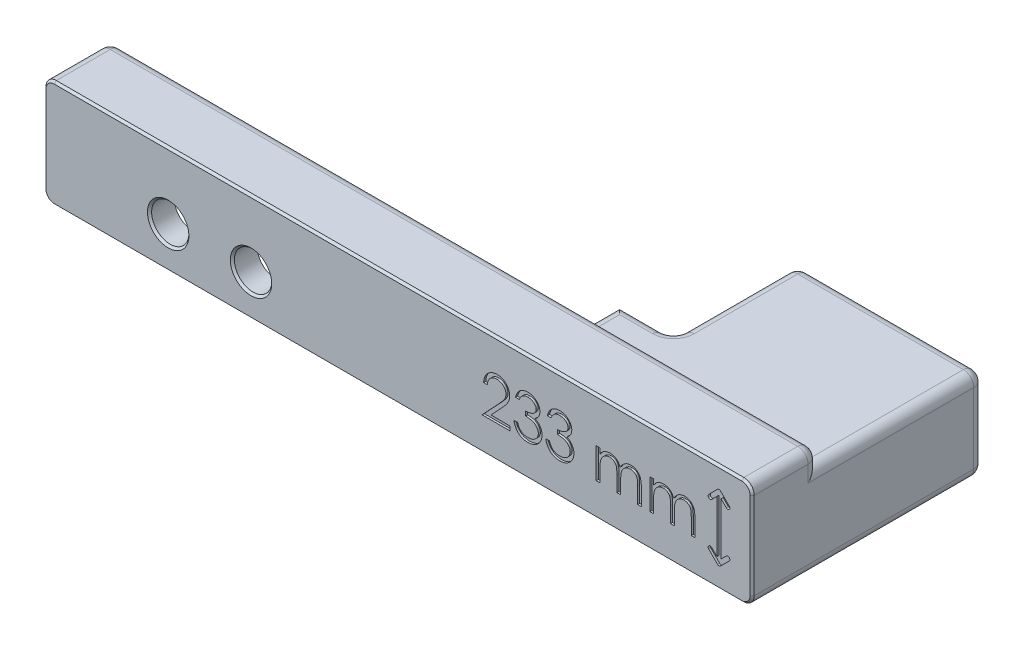
from build123d import *

# Parameters (mm, degrees)
MAIN_FEATURES_SKETCH_W   = 171
MAIN_FEATURES_SKETCH_H   = 26
MAIN_FEATURES_SKETCH_R   = 4.5
BASE_DEPTH               = 6
LEDGE_DEPTH              = 10
MAIN_FEATURES_SKETCH_4_W = 13
MAIN_FEATURES_SKETCH_4_H = 22.05
BOSS_EXTRUDE3_DEPTH      = 20
MAIN_FEATURES_SKETCH_5_W = 45
MAIN_FEATURES_SKETCH_5_H = 22.05
BOSS_EXTRUDE4_DEPTH      = 50
FILLET1_R                = 2.5
CHAMFER1_SIZE            = 0.5
CUT_EXTRUDE1_DEPTH       = 0.5
CUT_EXTRUDE2_DEPTH       = 0.5


with BuildPart() as part:
    # main_features_sketch → base (new body)
    with BuildSketch(Plane.XY):
        with Locations((79.5, 293)):
            Rectangle(MAIN_FEATURES_SKETCH_W, MAIN_FEATURES_SKETCH_H)
        with Locations((44, 290)):
            Circle(MAIN_FEATURES_SKETCH_R, mode=Mode.SUBTRACT)
        with Locations((24, 290)):
            Circle(MAIN_FEATURES_SKETCH_R, mode=Mode.SUBTRACT)
    extrude(amount=BASE_DEPTH)

    # main_features_sketch<3> → ledge (add)
    with BuildSketch(Plane.XY):
        Polygon((0, 280), (0, 300), (107, 300), (107, 302.05), (165, 302.05), (165, 306), (-6, 306), (-6, 280), align=None)
    extrude(amount=-LEDGE_DEPTH)

    # main_features_sketch<4> → Boss-Extrude3 (add)
    with BuildSketch(Plane.XY):
        with Locations((113.5, 291.025)):
            Rectangle(MAIN_FEATURES_SKETCH_4_W, MAIN_FEATURES_SKETCH_4_H)
    extrude(amount=-BOSS_EXTRUDE3_DEPTH)

    # main_features_sketch<5> → Boss-Extrude4 (add)
    with BuildSketch(Plane.XY):
        with Locations((142.5, 291.025)):
            Rectangle(MAIN_FEATURES_SKETCH_5_W, MAIN_FEATURES_SKETCH_5_H)
    extrude(amount=-BOSS_EXTRUDE4_DEPTH)

    # Fillet1
    fillet1_edges = [part.edges().sort_by_distance(p)[0] for p in [
        (113.5, 280, -20),
        (113.5, 302.05, -20),
        (142.5, 280, -50),
        (165, 291.025, -50),
        (142.5, 302.05, -50),
        (120, 291.025, -50),
        (165, 304.025, -10),
        (79.5, 306, -10),
        (-6, 293, -10),
        (0, 280, -5),
        (120, 291.025, -20),
        (120, 302.05, -35),
        (107, 302.05, -15),
        (120, 280, -35),
        (107, 280, -10),
        (-6, 280, -2),
        (-6, 306, -2),
        (165, 306, -2),
        (165, 302.05, -30),
        (165, 280, -22),
    ]]
    fillet(fillet1_edges, radius=FILLET1_R)

    # Chamfer1
    chamfer1_edges = [part.edges().sort_by_distance(p)[0] for p in [
        (39.5, 290, 6),
        (19.5, 290, 6),
        (-5.267766953, 305.267766953, 6),
        (79.5, 306, 6),
        (164.267766953, 305.267766953, 6),
        (165, 293, 6),
        (164.267766953, 280.732233047, 6),
        (79.5, 280, 6),
        (-5.267766953, 280.732233047, 6),
        (-6, 293, 6),
    ]]
    chamfer(chamfer1_edges, length=CHAMFER1_SIZE)

    # Sketch3 → Cut-Extrude1 (cut)
    with BuildSketch(Plane.XY.offset(6)):
        with BuildLine():
            Line((156.646446609, 300.853553391), (154.525126266, 298.732233047))
            ThreePointArc((154.525126266, 298.732233047), (154.525126266, 298.025126266), (155.232233047, 298.025126266))
            Line((155.232233047, 298.025126266), (157.353553391, 300.146446609))
            ThreePointArc((157.353553391, 300.146446609), (157.353553391, 300.853553391), (156.646446609, 300.853553391))
        make_face()
        with BuildLine():
            Line((156.5, 300.5), (156.5, 285.5))
            ThreePointArc((156.5, 285.5), (157, 285), (157.5, 285.5))
            Line((157.5, 285.5), (157.5, 300.5))
            ThreePointArc((157.5, 300.5), (157, 301), (156.5, 300.5))
        make_face()
        with BuildLine():
            Line((156.646446609, 300.146446609), (158.767766953, 298.025126266))
            ThreePointArc((158.767766953, 298.025126266), (159.474873734, 298.025126266), (159.474873734, 298.732233047))
            Line((159.474873734, 298.732233047), (157.353553391, 300.853553391))
            ThreePointArc((157.353553391, 300.853553391), (156.646446609, 300.853553391), (156.646446609, 300.146446609))
        make_face()
        with BuildLine():
            Line((157.353553391, 285.146446609), (159.474873734, 287.267766953))
            ThreePointArc((159.474873734, 287.267766953), (159.474873734, 287.974873734), (158.767766953, 287.974873734))
            Line((158.767766953, 287.974873734), (156.646446609, 285.853553391))
            ThreePointArc((156.646446609, 285.853553391), (156.646446609, 285.146446609), (157.353553391, 285.146446609))
        make_face()
        with BuildLine():
            Line((157.353553391, 285.853553391), (155.232233047, 287.974873734))
            ThreePointArc((155.232233047, 287.974873734), (154.525126266, 287.974873734), (154.525126266, 287.267766953))
            Line((154.525126266, 287.267766953), (156.646446609, 285.146446609))
            ThreePointArc((156.646446609, 285.146446609), (157.353553391, 285.146446609), (157.353553391, 285.853553391))
        make_face()
    extrude(amount=-CUT_EXTRUDE1_DEPTH, mode=Mode.SUBTRACT)

    # Sketch4 → Cut-Extrude2 (cut)
    with BuildSketch(Plane.XY.offset(6)):
        with BuildLine():
            Line((101.064783123, 294.923076923), (100.167347225, 294.923076923))
            add(Edge.make_bspline(
                [(100.167347225, 294.923076923), (100.173196234, 295.042136602), (100.184683531, 295.275966644), (100.238478643, 295.616892091), (100.315452578, 295.942762944), (100.424285304, 296.250962699), (100.559446098, 296.544216434), (100.72153189, 296.821359336), (100.91351432, 297.08133416), (101.131247846, 297.321730856), (101.367729672, 297.542266772), (101.622889499, 297.732710323), (101.891018148, 297.893617955), (102.171302145, 298.028135789), (102.466903756, 298.129106778), (102.775140492, 298.204025748), (103.097366596, 298.249101021), (103.316909517, 298.253946123), (103.428565174, 298.256410256)],
                knots=[0, 0, 0, 0, 1.10065271, 2.161652631, 3.183658789, 4.190468796, 5.17591951, 6.163126047, 7.15150782, 8.156236427, 9.156009102, 10.134482811, 11.092018607, 12.041330605, 13.001268258, 13.972401359, 14.968799086, 16, 16, 16, 16], degree=3))
            add(Edge.make_bspline(
                [(103.428565174, 298.256410256), (103.538216814, 298.253843238), (103.753678371, 298.248799139), (104.068141269, 298.205481912), (104.367504968, 298.137637364), (104.6511843, 298.042450461), (104.916915914, 297.914494954), (105.166696041, 297.760787701), (105.403498357, 297.583016754), (105.616660596, 297.373720144), (105.812397965, 297.15028476), (105.981261552, 296.911747892), (106.12587059, 296.665378505), (106.246406818, 296.409297929), (106.335138644, 296.14109499), (106.402504953, 295.864674411), (106.440583277, 295.577174951), (106.446427345, 295.382584792), (106.449398508, 295.283653846)],
                knots=[0, 0, 0, 0, 1.111607364, 2.184268762, 3.212621178, 4.221274766, 5.211760367, 6.196651075, 7.1921475, 8.207485113, 9.220403448, 10.201281604, 11.166441695, 12.114753415, 13.065576456, 14.026450734, 14.996634279, 16, 16, 16, 16], degree=3))
            add(Edge.make_bspline(
                [(106.449398508, 295.283653846), (106.444560614, 295.144374319), (106.434969724, 294.868259423), (106.352928648, 294.462502672), (106.224795759, 294.069378617), (106.070517597, 293.752986326), (105.914882042, 293.498033486), (105.774632021, 293.288122901), (105.610446846, 293.062107277), (105.419936852, 292.820743456), (105.207042932, 292.56214087), (104.969836751, 292.28645574), (104.706626802, 291.996536398), (104.521888229, 291.798520394), (104.426161328, 291.695913462)],
                knots=[0, 0, 0, 0, 1.184426356, 2.348067706, 3.509069118, 4.696110526, 5.333549288, 6.050745305, 6.844228056, 7.710549037, 8.667450064, 9.695053472, 10.805634456, 12, 12, 12, 12], degree=3))
            Line((104.426161328, 291.695913462), (101.924158123, 289.025641026))
            Line((101.924158123, 289.025641026), (106.577603636, 289.025641026))
            Line((106.577603636, 289.025641026), (106.577603636, 288))
            Line((106.577603636, 288), (99.782731841, 288))
            Line((99.782731841, 288), (103.660936969, 292.138621795))
            add(Edge.make_bspline(
                [(103.660936969, 292.138621795), (103.755359503, 292.237188385), (103.936725866, 292.426514632), (104.193247514, 292.70292309), (104.423644624, 292.959350349), (104.629408603, 293.195311916), (104.806075761, 293.414259253), (104.962853567, 293.609101263), (105.088469541, 293.788399693), (105.224799243, 293.996230018), (105.35683919, 294.249979496), (105.470303064, 294.560075751), (105.539488345, 294.879296473), (105.547787875, 295.095016578), (105.55196261, 295.203525641)],
                knots=[0, 0, 0, 0, 1.329631726, 2.553950428, 3.673215718, 4.687767853, 5.603093632, 6.413772471, 7.123043292, 7.734684054, 8.834405432, 9.900288307, 10.943827018, 12, 12, 12, 12], degree=3))
            add(Edge.make_bspline(
                [(105.55196261, 295.203525641), (105.550146204, 295.271758208), (105.546566415, 295.406231495), (105.514972994, 295.603390806), (105.46722869, 295.793575988), (105.398813667, 295.977372043), (105.308508696, 296.152931049), (105.198584753, 296.320466707), (105.071756001, 296.482435179), (104.925038088, 296.634301745), (104.763862317, 296.773390903), (104.593593033, 296.896602576), (104.413449878, 296.999571464), (104.224192386, 297.083981456), (104.026348187, 297.150196831), (103.81953463, 297.196078486), (103.604323155, 297.224885583), (103.45737031, 297.228783217), (103.382491456, 297.230769231)],
                knots=[0, 0, 0, 0, 0.991446411, 1.95395049, 2.89581595, 3.838931463, 4.798493298, 5.75982156, 6.748411868, 7.785213223, 8.824556874, 9.840280684, 10.836137867, 11.835679398, 12.848801643, 13.863922112, 14.911575587, 16, 16, 16, 16], degree=3))
            add(Edge.make_bspline(
                [(103.382491456, 297.230769231), (103.304289077, 297.228726281), (103.150712516, 297.224714266), (102.925229565, 297.196649512), (102.710127344, 297.148232825), (102.504864764, 297.082013755), (102.309094519, 296.997846473), (102.123768678, 296.893012917), (101.949303281, 296.767917222), (101.785370357, 296.626087061), (101.634330417, 296.468179629), (101.501625057, 296.292151163), (101.385670731, 296.101215691), (101.284501492, 295.895888403), (101.202342378, 295.674306175), (101.139561948, 295.43725559), (101.089885243, 295.185765928), (101.07328947, 295.012094257), (101.064783123, 294.923076923)],
                knots=[0, 0, 0, 0, 1.031018746, 2.02475058, 2.990194455, 3.934040569, 4.864654155, 5.795059489, 6.735614925, 7.690564532, 8.649604399, 9.611025574, 10.590972636, 11.591080095, 12.624614302, 13.701020113, 14.821632451, 16, 16, 16, 16], degree=3))
        make_face()
        with BuildLine():
            Line((108.757090815, 295.692307692), (107.859654918, 295.692307692))
            add(Edge.make_bspline(
                [(107.859654918, 295.692307692), (107.88396792, 295.792971932), (107.93149785, 295.989762288), (108.030633774, 296.27092589), (108.138631646, 296.536993094), (108.268314802, 296.782981876), (108.409768385, 297.013835884), (108.571833304, 297.224319097), (108.747032511, 297.419784712), (108.940818081, 297.593251105), (109.144042828, 297.750330332), (109.359570313, 297.884259067), (109.583064295, 297.999470932), (109.816073247, 298.09438588), (110.05929088, 298.165887377), (110.310518375, 298.217763964), (110.57041409, 298.251452862), (110.746835777, 298.254740756), (110.836417738, 298.256410256)],
                knots=[0, 0, 0, 0, 1.162005537, 2.271625781, 3.343758855, 4.383309926, 5.390229558, 6.379919256, 7.361854164, 8.333198761, 9.295911338, 10.242430842, 11.177959212, 12.116337295, 13.062827104, 14.020064771, 14.994644689, 16, 16, 16, 16], degree=3))
            add(Edge.make_bspline(
                [(110.836417738, 298.256410256), (110.966939859, 298.252469599), (111.225137033, 298.24467424), (111.604460024, 298.173490136), (111.970250936, 298.060846901), (112.318505929, 297.90520768), (112.641987165, 297.713243928), (112.929804842, 297.484773251), (113.17805773, 297.224203819), (113.38632738, 296.936396492), (113.549398806, 296.628809322), (113.669645588, 296.312237445), (113.74285039, 295.987431812), (113.752337696, 295.7681253), (113.757090815, 295.658253205)],
                knots=[0, 0, 0, 0, 1.083050992, 2.142477498, 3.193116406, 4.255571735, 5.30263384, 6.308962982, 7.297363603, 8.282367274, 9.249857812, 10.179914175, 11.08814088, 12, 12, 12, 12], degree=3))
            add(Edge.make_bspline(
                [(113.757090815, 295.658253205), (113.753766269, 295.552519506), (113.747260649, 295.345615065), (113.69202149, 295.043553644), (113.599060739, 294.758863358), (113.470289989, 294.490345752), (113.303599845, 294.239703352), (113.101677854, 294.006372235), (112.863098821, 293.789317498), (112.682301855, 293.664976147), (112.589222225, 293.600961538)],
                knots=[0, 0, 0, 0, 1.024540389, 2.004866551, 2.965041327, 3.920577974, 4.882998113, 5.874504559, 6.905732034, 8, 8, 8, 8], degree=3))
            add(Edge.make_bspline(
                [(112.589222225, 293.600961538), (112.695598667, 293.549595334), (112.906361165, 293.447824027), (113.193648392, 293.248236148), (113.454442322, 293.017789441), (113.599881519, 292.83795329), (113.6729562, 292.747596154)],
                knots=[0, 0, 0, 0, 1.015518401, 2.012035669, 3.001164323, 4, 4, 4, 4], degree=3))
            add(Edge.make_bspline(
                [(113.6729562, 292.747596154), (113.721074321, 292.681716864), (113.816522595, 292.551037102), (113.934338406, 292.340933028), (114.04122159, 292.128500201), (114.124507931, 291.908044756), (114.189004693, 291.682121859), (114.235107642, 291.450343585), (114.263748045, 291.212520664), (114.267849622, 291.051627863), (114.269911328, 290.970753205)],
                knots=[0, 0, 0, 0, 1.025084078, 2.033381695, 3.024893161, 4.013698104, 4.991890475, 5.976764909, 6.982997093, 8, 8, 8, 8], degree=3))
            add(Edge.make_bspline(
                [(114.269911328, 290.970753205), (114.264784147, 290.83072543), (114.254553912, 290.551328854), (114.1631137, 290.138543935), (114.021361584, 289.7350425), (113.820056052, 289.349114387), (113.574720313, 288.988027585), (113.282842244, 288.664952416), (112.94773822, 288.387242118), (112.574007794, 288.155212895), (112.169101713, 287.969733117), (111.736028593, 287.840997566), (111.281028439, 287.757151853), (110.969007589, 287.748160799), (110.810376072, 287.743589744)],
                knots=[0, 0, 0, 0, 0.955779014, 1.907060117, 2.875433937, 3.871313158, 4.872415639, 5.851225146, 6.836215519, 7.83643374, 8.849228613, 9.86973379, 10.916971861, 12, 12, 12, 12], degree=3))
            add(Edge.make_bspline(
                [(110.810376072, 287.743589744), (110.703463785, 287.746070353), (110.493096056, 287.750951365), (110.183828918, 287.784318797), (109.888624063, 287.845261669), (109.607082355, 287.927271113), (109.338953679, 288.031247519), (109.085056236, 288.160729513), (108.843827969, 288.31304809), (108.617545251, 288.490001198), (108.406235058, 288.687947883), (108.215512988, 288.910402198), (108.042199294, 289.153251923), (107.890934612, 289.419317798), (107.754829033, 289.70516139), (107.642883443, 290.014442814), (107.544353247, 290.344397163), (107.498543349, 290.574333563), (107.475039533, 290.692307692)],
                knots=[0, 0, 0, 0, 1.048658725, 2.063410685, 3.046034179, 4.001477787, 4.936774919, 5.862367409, 6.792675028, 7.730719943, 8.675894397, 9.627829632, 10.600096036, 11.597688215, 12.626045268, 13.701542398, 14.82072376, 16, 16, 16, 16], degree=3))
            Line((107.475039533, 290.692307692), (108.372475431, 290.692307692))
            add(Edge.make_bspline(
                [(108.372475431, 290.692307692), (108.395856263, 290.615310512), (108.441334014, 290.465544307), (108.518746294, 290.250000576), (108.606941357, 290.052406139), (108.701554382, 289.871311504), (108.80092137, 289.704933212), (108.912106871, 289.557670729), (109.026875857, 289.423055865), (109.113388295, 289.347214117), (109.155728636, 289.310096154)],
                knots=[0, 0, 0, 0, 1.198163088, 2.33053128, 3.407730985, 4.417276592, 5.372219308, 6.28897303, 7.162600585, 8, 8, 8, 8], degree=3))
            add(Edge.make_bspline(
                [(109.155728636, 289.310096154), (109.211718854, 289.266929486), (109.323526463, 289.180729395), (109.505721409, 289.070724742), (109.697335369, 288.975407527), (109.902520152, 288.902596967), (110.116848068, 288.840946508), (110.343783397, 288.800602168), (110.581324017, 288.772921678), (110.743517627, 288.770479017), (110.826401713, 288.769230769)],
                knots=[0, 0, 0, 0, 0.946170439, 1.889420265, 2.845303464, 3.807233317, 4.801018734, 5.828864929, 6.890507805, 8, 8, 8, 8], degree=3))
            add(Edge.make_bspline(
                [(110.826401713, 288.769230769), (110.919983149, 288.770990499), (111.102973569, 288.774431497), (111.369987452, 288.806076374), (111.624008731, 288.852163269), (111.86221709, 288.92334322), (112.087732826, 289.01128851), (112.297394682, 289.121712526), (112.493954985, 289.251268873), (112.674896144, 289.398523612), (112.837597594, 289.559727884), (112.980853346, 289.728336659), (113.102638093, 289.903639029), (113.200876888, 290.086605088), (113.278449889, 290.276477171), (113.331259033, 290.473788112), (113.367977648, 290.676923158), (113.370967968, 290.815005927), (113.372475431, 290.884615385)],
                knots=[0, 0, 0, 0, 1.217147791, 2.380027433, 3.494444702, 4.572153297, 5.609568379, 6.639424714, 7.649109417, 8.668170816, 9.669597737, 10.625200337, 11.543417969, 12.441394052, 13.322311151, 14.205496177, 15.095365482, 16, 16, 16, 16], degree=3))
            add(Edge.make_bspline(
                [(113.372475431, 290.884615385), (113.368103141, 290.977790639), (113.359380316, 291.163677519), (113.292784375, 291.437156303), (113.183244763, 291.700651767), (113.029894731, 291.94966831), (112.84322122, 292.1804566), (112.625035772, 292.386375122), (112.373526548, 292.556289667), (112.142041208, 292.673685829), (111.936997904, 292.753791758), (111.761525377, 292.807148799), (111.565077939, 292.852330672), (111.350031228, 292.894365734), (111.114764895, 292.930141014), (110.859535072, 292.959974774), (110.584290039, 292.983846319), (110.393743851, 292.994506591), (110.295552354, 293)],
                knots=[0, 0, 0, 0, 1.07054697, 2.135767047, 3.216561865, 4.33974944, 5.486079747, 6.621378074, 7.775625952, 8.963672916, 9.598146892, 10.304877434, 11.070270905, 11.915000392, 12.823868403, 13.805723172, 14.86925407, 16, 16, 16, 16], degree=3))
            Line((110.295552354, 293), (110.295552354, 294.025641026))
            add(Edge.make_bspline(
                [(110.295552354, 294.025641026), (110.41926997, 294.027740465), (110.661602389, 294.031852751), (111.015586117, 294.081589923), (111.354081294, 294.150391718), (111.669586271, 294.255777981), (111.957154024, 294.378178829), (112.206638601, 294.520613714), (112.414544736, 294.678941569), (112.579862083, 294.855606167), (112.704231308, 295.045077731), (112.795165015, 295.242553896), (112.848880233, 295.449765498), (112.85605071, 295.591178835), (112.859654918, 295.662259615)],
                knots=[0, 0, 0, 0, 1.321986639, 2.589447074, 3.816329219, 5.01088745, 6.139805852, 7.153945165, 8.075214402, 8.924034688, 9.728124013, 10.488707548, 11.240355623, 12, 12, 12, 12], degree=3))
            add(Edge.make_bspline(
                [(112.859654918, 295.662259615), (112.858470886, 295.714481744), (112.856115312, 295.818375193), (112.826408804, 295.970161104), (112.781768687, 296.117306664), (112.720398032, 296.259186121), (112.638254607, 296.394815475), (112.539951789, 296.525351044), (112.422900074, 296.650047555), (112.288770225, 296.76627704), (112.144736496, 296.877046289), (111.986879996, 296.971085252), (111.819960354, 297.051499715), (111.643792769, 297.117812578), (111.457805539, 297.167696258), (111.262872518, 297.203512948), (111.058621993, 297.225906247), (110.919274188, 297.229130293), (110.848436969, 297.230769231)],
                knots=[0, 0, 0, 0, 0.884392785, 1.759457502, 2.611959086, 3.489218968, 4.37281399, 5.2945488, 6.255912374, 7.266815255, 8.301784654, 9.332968512, 10.37626691, 11.440494194, 12.520033166, 13.637162961, 14.798855837, 16, 16, 16, 16], degree=3))
            add(Edge.make_bspline(
                [(110.848436969, 297.230769231), (110.734575061, 297.226793911), (110.512176271, 297.219029186), (110.191562223, 297.151020576), (109.893506983, 297.042511766), (109.665682221, 296.912988854), (109.497446295, 296.785130471), (109.377226471, 296.67346651), (109.25916787, 296.549372728), (109.151037365, 296.405205942), (109.041683146, 296.250729398), (108.942127256, 296.078090308), (108.845385278, 295.891792039), (108.787092279, 295.760090226), (108.757090815, 295.692307692)],
                knots=[0, 0, 0, 0, 1.472543308, 2.876219568, 4.221790263, 5.565193594, 6.249813518, 6.953379497, 7.687249741, 8.463570142, 9.283606569, 10.136032583, 11.040678096, 12, 12, 12, 12], degree=3))
        make_face()
        with BuildLine():
            Line((116.449398508, 295.692307692), (115.55196261, 295.692307692))
            add(Edge.make_bspline(
                [(115.55196261, 295.692307692), (115.576275612, 295.792971932), (115.623805542, 295.989762288), (115.722941466, 296.27092589), (115.830939338, 296.536993094), (115.960622494, 296.782981876), (116.102076078, 297.013835884), (116.264140996, 297.224319097), (116.439340204, 297.419784712), (116.633125773, 297.593251105), (116.836350521, 297.750330332), (117.051878006, 297.884259067), (117.275371988, 297.999470932), (117.508380939, 298.09438588), (117.751598572, 298.165887377), (118.002826068, 298.217763964), (118.262721782, 298.251452862), (118.43914347, 298.254740756), (118.528725431, 298.256410256)],
                knots=[0, 0, 0, 0, 1.162005537, 2.271625781, 3.343758855, 4.383309926, 5.390229558, 6.379919256, 7.361854164, 8.333198761, 9.295911338, 10.242430842, 11.177959212, 12.116337295, 13.062827104, 14.020064771, 14.994644689, 16, 16, 16, 16], degree=3))
            add(Edge.make_bspline(
                [(118.528725431, 298.256410256), (118.659247551, 298.252469599), (118.917444725, 298.24467424), (119.296767716, 298.173490136), (119.662558628, 298.060846901), (120.010813622, 297.90520768), (120.334294858, 297.713243928), (120.622112534, 297.484773251), (120.870365422, 297.224203819), (121.078635073, 296.936396492), (121.241706498, 296.628809322), (121.36195328, 296.312237445), (121.435158083, 295.987431812), (121.444645388, 295.7681253), (121.449398508, 295.658253205)],
                knots=[0, 0, 0, 0, 1.083050992, 2.142477498, 3.193116406, 4.255571735, 5.30263384, 6.308962982, 7.297363603, 8.282367274, 9.249857812, 10.179914175, 11.08814088, 12, 12, 12, 12], degree=3))
            add(Edge.make_bspline(
                [(121.449398508, 295.658253205), (121.446073962, 295.552519506), (121.439568341, 295.345615065), (121.384329183, 295.043553644), (121.291368432, 294.758863358), (121.162597681, 294.490345752), (120.995907538, 294.239703352), (120.793985547, 294.006372235), (120.555406513, 293.789317498), (120.374609547, 293.664976147), (120.281529918, 293.600961538)],
                knots=[0, 0, 0, 0, 1.024540389, 2.004866551, 2.965041327, 3.920577974, 4.882998113, 5.874504559, 6.905732034, 8, 8, 8, 8], degree=3))
            add(Edge.make_bspline(
                [(120.281529918, 293.600961538), (120.387906359, 293.549595334), (120.598668857, 293.447824027), (120.885956085, 293.248236148), (121.146750014, 293.017789441), (121.292189211, 292.83795329), (121.365263892, 292.747596154)],
                knots=[0, 0, 0, 0, 1.015518401, 2.012035669, 3.001164323, 4, 4, 4, 4], degree=3))
            add(Edge.make_bspline(
                [(121.365263892, 292.747596154), (121.413382013, 292.681716864), (121.508830288, 292.551037102), (121.626646098, 292.340933028), (121.733529282, 292.128500201), (121.816815623, 291.908044756), (121.881312385, 291.682121859), (121.927415335, 291.450343585), (121.956055737, 291.212520664), (121.960157314, 291.051627863), (121.96221902, 290.970753205)],
                knots=[0, 0, 0, 0, 1.025084078, 2.033381695, 3.024893161, 4.013698104, 4.991890475, 5.976764909, 6.982997093, 8, 8, 8, 8], degree=3))
            add(Edge.make_bspline(
                [(121.96221902, 290.970753205), (121.957091839, 290.83072543), (121.946861605, 290.551328854), (121.855421392, 290.138543935), (121.713669276, 289.7350425), (121.512363745, 289.349114387), (121.267028005, 288.988027585), (120.975149936, 288.664952416), (120.640045912, 288.387242118), (120.266315487, 288.155212895), (119.861409405, 287.969733117), (119.428336285, 287.840997566), (118.973336131, 287.757151853), (118.661315281, 287.748160799), (118.502683764, 287.743589744)],
                knots=[0, 0, 0, 0, 0.955779014, 1.907060117, 2.875433937, 3.871313158, 4.872415639, 5.851225146, 6.836215519, 7.83643374, 8.849228613, 9.86973379, 10.916971861, 12, 12, 12, 12], degree=3))
            add(Edge.make_bspline(
                [(118.502683764, 287.743589744), (118.395771477, 287.746070353), (118.185403749, 287.750951365), (117.87613661, 287.784318797), (117.580931755, 287.845261669), (117.299390047, 287.927271113), (117.031261372, 288.031247519), (116.777363928, 288.160729513), (116.536135661, 288.31304809), (116.309852943, 288.490001198), (116.09854275, 288.687947883), (115.907820681, 288.910402198), (115.734506987, 289.153251923), (115.583242305, 289.419317798), (115.447136726, 289.70516139), (115.335191135, 290.014442814), (115.236660939, 290.344397163), (115.190851041, 290.574333563), (115.167347225, 290.692307692)],
                knots=[0, 0, 0, 0, 1.048658725, 2.063410685, 3.046034179, 4.001477787, 4.936774919, 5.862367409, 6.792675028, 7.730719943, 8.675894397, 9.627829632, 10.600096036, 11.597688215, 12.626045268, 13.701542398, 14.82072376, 16, 16, 16, 16], degree=3))
            Line((115.167347225, 290.692307692), (116.064783123, 290.692307692))
            add(Edge.make_bspline(
                [(116.064783123, 290.692307692), (116.088163956, 290.615310512), (116.133641706, 290.465544307), (116.211053986, 290.250000576), (116.299249049, 290.052406139), (116.393862074, 289.871311504), (116.493229063, 289.704933212), (116.604414563, 289.557670729), (116.719183549, 289.423055865), (116.805695987, 289.347214117), (116.848036328, 289.310096154)],
                knots=[0, 0, 0, 0, 1.198163088, 2.33053128, 3.407730985, 4.417276592, 5.372219308, 6.28897303, 7.162600585, 8, 8, 8, 8], degree=3))
            add(Edge.make_bspline(
                [(116.848036328, 289.310096154), (116.904026547, 289.266929486), (117.015834155, 289.180729395), (117.198029101, 289.070724742), (117.389643061, 288.975407527), (117.594827845, 288.902596967), (117.80915576, 288.840946508), (118.036091089, 288.800602168), (118.27363171, 288.772921678), (118.43582532, 288.770479017), (118.518709405, 288.769230769)],
                knots=[0, 0, 0, 0, 0.946170439, 1.889420265, 2.845303464, 3.807233317, 4.801018734, 5.828864929, 6.890507805, 8, 8, 8, 8], degree=3))
            add(Edge.make_bspline(
                [(118.518709405, 288.769230769), (118.612290841, 288.770990499), (118.795281261, 288.774431497), (119.062295145, 288.806076374), (119.316316423, 288.852163269), (119.554524783, 288.92334322), (119.780040518, 289.01128851), (119.989702374, 289.121712526), (120.186262678, 289.251268873), (120.367203836, 289.398523612), (120.529905286, 289.559727884), (120.673161038, 289.728336659), (120.794945785, 289.903639029), (120.89318458, 290.086605088), (120.970757581, 290.276477171), (121.023566725, 290.473788112), (121.06028534, 290.676923158), (121.06327566, 290.815005927), (121.064783123, 290.884615385)],
                knots=[0, 0, 0, 0, 1.217147791, 2.380027433, 3.494444702, 4.572153297, 5.609568379, 6.639424714, 7.649109417, 8.668170816, 9.669597737, 10.625200337, 11.543417969, 12.441394052, 13.322311151, 14.205496177, 15.095365482, 16, 16, 16, 16], degree=3))
            add(Edge.make_bspline(
                [(121.064783123, 290.884615385), (121.060410833, 290.977790639), (121.051688009, 291.163677519), (120.985092067, 291.437156303), (120.875552455, 291.700651767), (120.722202423, 291.94966831), (120.535528913, 292.1804566), (120.317343464, 292.386375122), (120.065834241, 292.556289667), (119.8343489, 292.673685829), (119.629305596, 292.753791758), (119.453833069, 292.807148799), (119.257385631, 292.852330672), (119.04233892, 292.894365734), (118.807072587, 292.930141014), (118.551842764, 292.959974774), (118.276597731, 292.983846319), (118.086051543, 292.994506591), (117.987860046, 293)],
                knots=[0, 0, 0, 0, 1.07054697, 2.135767047, 3.216561865, 4.33974944, 5.486079747, 6.621378074, 7.775625952, 8.963672916, 9.598146892, 10.304877434, 11.070270905, 11.915000392, 12.823868403, 13.805723172, 14.86925407, 16, 16, 16, 16], degree=3))
            Line((117.987860046, 293), (117.987860046, 294.025641026))
            add(Edge.make_bspline(
                [(117.987860046, 294.025641026), (118.111577662, 294.027740465), (118.353910081, 294.031852751), (118.707893809, 294.081589923), (119.046388986, 294.150391718), (119.361893964, 294.255777981), (119.649461716, 294.378178829), (119.898946293, 294.520613714), (120.106852429, 294.678941569), (120.272169776, 294.855606167), (120.396539, 295.045077731), (120.487472707, 295.242553896), (120.541187925, 295.449765498), (120.548358402, 295.591178835), (120.55196261, 295.662259615)],
                knots=[0, 0, 0, 0, 1.321986639, 2.589447074, 3.816329219, 5.01088745, 6.139805852, 7.153945165, 8.075214402, 8.924034688, 9.728124013, 10.488707548, 11.240355623, 12, 12, 12, 12], degree=3))
            add(Edge.make_bspline(
                [(120.55196261, 295.662259615), (120.550778579, 295.714481744), (120.548423005, 295.818375193), (120.518716497, 295.970161104), (120.47407638, 296.117306664), (120.412705724, 296.259186121), (120.3305623, 296.394815475), (120.232259481, 296.525351044), (120.115207766, 296.650047555), (119.981077917, 296.76627704), (119.837044189, 296.877046289), (119.679187689, 296.971085252), (119.512268047, 297.051499715), (119.336100461, 297.117812578), (119.150113232, 297.167696258), (118.95518021, 297.203512948), (118.750929686, 297.225906247), (118.61158188, 297.229130293), (118.540744661, 297.230769231)],
                knots=[0, 0, 0, 0, 0.884392785, 1.759457502, 2.611959086, 3.489218968, 4.37281399, 5.2945488, 6.255912374, 7.266815255, 8.301784654, 9.332968512, 10.37626691, 11.440494194, 12.520033166, 13.637162961, 14.798855837, 16, 16, 16, 16], degree=3))
            add(Edge.make_bspline(
                [(118.540744661, 297.230769231), (118.426882753, 297.226793911), (118.204483963, 297.219029186), (117.883869915, 297.151020576), (117.585814675, 297.042511766), (117.357989913, 296.912988854), (117.189753987, 296.785130471), (117.069534164, 296.67346651), (116.951475562, 296.549372728), (116.843345057, 296.405205942), (116.733990838, 296.250729398), (116.634434948, 296.078090308), (116.53769297, 295.891792039), (116.479399971, 295.760090226), (116.449398508, 295.692307692)],
                knots=[0, 0, 0, 0, 1.472543308, 2.876219568, 4.221790263, 5.565193594, 6.249813518, 6.953379497, 7.687249741, 8.463570142, 9.283606569, 10.136032583, 11.040678096, 12, 12, 12, 12], degree=3))
        make_face()
        with BuildLine():
            Line((127.346834405, 295.307692308), (128.244270302, 295.307692308))
            Line((128.244270302, 295.307692308), (128.244270302, 294.037660256))
            add(Edge.make_bspline(
                [(128.244270302, 294.037660256), (128.325081588, 294.14876769), (128.479923758, 294.361660184), (128.733825622, 294.642203854), (128.987471658, 294.880284296), (129.170138463, 295.005263929), (129.257892097, 295.065304487)],
                knots=[0, 0, 0, 0, 1.134379233, 2.173579362, 3.122582517, 4, 4, 4, 4], degree=3))
            add(Edge.make_bspline(
                [(129.257892097, 295.065304487), (129.377505418, 295.122462674), (129.614642274, 295.235780426), (129.990125774, 295.350733452), (130.374339115, 295.421376598), (130.633791155, 295.431037665), (130.764302354, 295.435897436)],
                knots=[0, 0, 0, 0, 1.014936303, 2.012140481, 3.000054389, 4, 4, 4, 4], degree=3))
            add(Edge.make_bspline(
                [(130.764302354, 295.435897436), (130.852568058, 295.432910891), (131.027241141, 295.427000679), (131.286052827, 295.388543435), (131.537077432, 295.322068655), (131.778831802, 295.229476301), (132.006605171, 295.11734291), (132.215431451, 294.985772316), (132.402929188, 294.838066386), (132.569003621, 294.667555149), (132.718343693, 294.469450582), (132.855711826, 294.238409871), (132.982641005, 293.969245125), (133.052987601, 293.773912151), (133.090023508, 293.671073718)],
                knots=[0, 0, 0, 0, 1.009824226, 1.998387844, 2.986035974, 3.974953746, 4.955485308, 5.885931332, 6.793869504, 7.679848016, 8.601185859, 9.625726857, 10.749998409, 12, 12, 12, 12], degree=3))
            add(Edge.make_bspline(
                [(133.090023508, 293.671073718), (133.129198511, 293.741714916), (133.206289417, 293.880726873), (133.335734095, 294.077464765), (133.47135637, 294.26148417), (133.614312065, 294.432931097), (133.764096599, 294.590958898), (133.921414885, 294.736090046), (134.085371404, 294.868947799), (134.313349232, 295.024156826), (134.609956682, 295.189017345), (134.983922724, 295.331955756), (135.372923214, 295.420287551), (135.636973781, 295.430659759), (135.770311969, 295.435897436)],
                knots=[0, 0, 0, 0, 0.86119277, 1.694706429, 2.50939023, 3.298075842, 4.073795165, 4.829715201, 5.57930267, 6.321991688, 7.768977793, 9.186738141, 10.579381044, 12, 12, 12, 12], degree=3))
            add(Edge.make_bspline(
                [(135.770311969, 295.435897436), (135.892830434, 295.431276805), (136.132610966, 295.422233781), (136.481688868, 295.351223858), (136.807236884, 295.229287723), (137.108599958, 295.062905904), (137.38048514, 294.853822523), (137.616817451, 294.605054416), (137.816161347, 294.318361207), (137.946386032, 294.048669811), (138.034715358, 293.81056886), (138.089176027, 293.607693742), (138.137289442, 293.384403591), (138.177235857, 293.140431415), (138.20643172, 292.874915391), (138.228062336, 292.588290032), (138.242702546, 292.28033257), (138.243737038, 292.067859712), (138.244270302, 291.958333333)],
                knots=[0, 0, 0, 0, 1.209669288, 2.367440248, 3.500751976, 4.631527125, 5.755587489, 6.87532382, 8.007944318, 9.190864318, 9.82315674, 10.514484317, 11.263564316, 12.079023757, 12.955305781, 13.901327259, 14.918167583, 16, 16, 16, 16], degree=3))
            Line((138.244270302, 291.958333333), (138.244270302, 288))
            Line((138.244270302, 288), (137.346834405, 288))
            Line((137.346834405, 288), (137.346834405, 291.962339744))
            add(Edge.make_bspline(
                [(137.346834405, 291.962339744), (137.346611882, 292.055827098), (137.346184227, 292.235495574), (137.338488137, 292.493359721), (137.32398724, 292.72841217), (137.307031129, 292.940332422), (137.283477388, 293.129614675), (137.25306044, 293.295878728), (137.220838498, 293.440432474), (137.167307094, 293.600678325), (137.08174169, 293.777450355), (136.951406032, 293.968089143), (136.787205729, 294.134034286), (136.597605282, 294.27808662), (136.381752582, 294.395211309), (136.143853373, 294.478857051), (135.885384655, 294.530636703), (135.706462402, 294.535796748), (135.614061969, 294.538461538)],
                knots=[0, 0, 0, 0, 1.253487763, 2.409012846, 3.458416907, 4.410876679, 5.259312806, 6.014470957, 6.676830364, 7.243083969, 8.276244668, 9.299465089, 10.325150304, 11.392391894, 12.482080715, 13.603491619, 14.762376348, 16, 16, 16, 16], degree=3))
            add(Edge.make_bspline(
                [(135.614061969, 294.538461538), (135.500719242, 294.534415374), (135.276710925, 294.526418616), (134.949723821, 294.444778979), (134.635520917, 294.321692549), (134.34347768, 294.1433141), (134.074826849, 293.929575917), (133.843685199, 293.675434215), (133.652736097, 293.387920138), (133.523439022, 293.121786703), (133.441755305, 292.882731149), (133.38782126, 292.673881515), (133.345868713, 292.436505607), (133.306524343, 292.17219849), (133.280845121, 291.879140832), (133.257506914, 291.558688258), (133.246590163, 291.209876945), (133.245063138, 290.968086406), (133.244270302, 290.842548077)],
                knots=[0, 0, 0, 0, 1.090531906, 2.155305635, 3.229839962, 4.33261226, 5.44038871, 6.529323825, 7.629011124, 8.757537029, 9.370236727, 10.061839251, 10.834451254, 11.692844982, 12.636905849, 13.66920014, 14.789842145, 16, 16, 16, 16], degree=3))
            Line((133.244270302, 290.842548077), (133.244270302, 288))
            Line((133.244270302, 288), (132.346834405, 288))
            Line((132.346834405, 288), (132.346834405, 291.715945513))
            add(Edge.make_bspline(
                [(132.346834405, 291.715945513), (132.346607459, 291.820783566), (132.346170839, 292.022481444), (132.338524218, 292.311720516), (132.323991013, 292.574809317), (132.307189446, 292.81144207), (132.283017508, 293.021188724), (132.255561044, 293.205173747), (132.223136443, 293.362935893), (132.169451058, 293.535974135), (132.08740972, 293.726605344), (131.955443257, 293.929865404), (131.790850171, 294.107774254), (131.597790525, 294.259656393), (131.380631433, 294.385203482), (131.14067886, 294.475659916), (130.880093394, 294.528300743), (130.700442806, 294.535010734), (130.608052354, 294.538461538)],
                knots=[0, 0, 0, 0, 1.320475261, 2.540461679, 3.643808994, 4.639130445, 5.527981419, 6.302341397, 6.981980563, 7.553956391, 8.582137848, 9.585246428, 10.591171744, 11.620968678, 12.668337649, 13.738356861, 14.836885341, 16, 16, 16, 16], degree=3))
            add(Edge.make_bspline(
                [(130.608052354, 294.538461538), (130.499434607, 294.534088796), (130.282963294, 294.525374074), (129.964957667, 294.446933292), (129.657855713, 294.324064507), (129.366556574, 294.153607881), (129.09891615, 293.942467656), (128.864606815, 293.694139383), (128.667628171, 293.411713573), (128.536965842, 293.148386383), (128.452684488, 292.915319883), (128.396697817, 292.717174318), (128.348584601, 292.497173609), (128.312830253, 292.254639006), (128.27831478, 291.991150165), (128.261656754, 291.70539448), (128.245452291, 291.397617087), (128.244673963, 291.1851241), (128.244270302, 291.074919872)],
                knots=[0, 0, 0, 0, 1.098833095, 2.189935336, 3.297829714, 4.440610912, 5.596351641, 6.740013378, 7.886572111, 9.072425424, 9.705826452, 10.395263256, 11.156850408, 11.985370555, 12.878090359, 13.847760091, 14.883794034, 16, 16, 16, 16], degree=3))
            Line((128.244270302, 291.074919872), (128.244270302, 288))
            Line((128.244270302, 288), (127.346834405, 288))
            Line((127.346834405, 288), (127.346834405, 295.307692308))
        make_face()
        with BuildLine():
            Line((140.295552354, 295.307692308), (141.192988251, 295.307692308))
            Line((141.192988251, 295.307692308), (141.192988251, 294.037660256))
            add(Edge.make_bspline(
                [(141.192988251, 294.037660256), (141.273799537, 294.14876769), (141.428641707, 294.361660184), (141.682543571, 294.642203854), (141.936189607, 294.880284296), (142.118856412, 295.005263929), (142.206610046, 295.065304487)],
                knots=[0, 0, 0, 0, 1.134379233, 2.173579362, 3.122582517, 4, 4, 4, 4], degree=3))
            add(Edge.make_bspline(
                [(142.206610046, 295.065304487), (142.326223367, 295.122462674), (142.563360223, 295.235780426), (142.938843723, 295.350733452), (143.323057064, 295.421376598), (143.582509104, 295.431037665), (143.713020302, 295.435897436)],
                knots=[0, 0, 0, 0, 1.014936303, 2.012140481, 3.000054389, 4, 4, 4, 4], degree=3))
            add(Edge.make_bspline(
                [(143.713020302, 295.435897436), (143.801286007, 295.432910891), (143.97595909, 295.427000679), (144.234770776, 295.388543435), (144.485795381, 295.322068655), (144.727549751, 295.229476301), (144.95532312, 295.11734291), (145.164149399, 294.985772316), (145.351647137, 294.838066386), (145.517721569, 294.667555149), (145.667061642, 294.469450582), (145.804429775, 294.238409871), (145.931358953, 293.969245125), (146.00170555, 293.773912151), (146.038741456, 293.671073718)],
                knots=[0, 0, 0, 0, 1.009824226, 1.998387844, 2.986035974, 3.974953746, 4.955485308, 5.885931332, 6.793869504, 7.679848016, 8.601185859, 9.625726857, 10.749998409, 12, 12, 12, 12], degree=3))
            add(Edge.make_bspline(
                [(146.038741456, 293.671073718), (146.07791646, 293.741714916), (146.155007366, 293.880726873), (146.284452044, 294.077464765), (146.420074319, 294.26148417), (146.563030014, 294.432931097), (146.712814547, 294.590958898), (146.870132834, 294.736090046), (147.034089352, 294.868947799), (147.262067181, 295.024156826), (147.55867463, 295.189017345), (147.932640672, 295.331955756), (148.321641163, 295.420287551), (148.585691729, 295.430659759), (148.719029918, 295.435897436)],
                knots=[0, 0, 0, 0, 0.86119277, 1.694706429, 2.50939023, 3.298075842, 4.073795165, 4.829715201, 5.57930267, 6.321991688, 7.768977793, 9.186738141, 10.579381044, 12, 12, 12, 12], degree=3))
            add(Edge.make_bspline(
                [(148.719029918, 295.435897436), (148.841548383, 295.431276805), (149.081328915, 295.422233781), (149.430406817, 295.351223858), (149.755954832, 295.229287723), (150.057317907, 295.062905904), (150.329203088, 294.853822523), (150.5655354, 294.605054416), (150.764879295, 294.318361207), (150.89510398, 294.048669811), (150.983433307, 293.81056886), (151.037893976, 293.607693742), (151.086007391, 293.384403591), (151.125953806, 293.140431415), (151.155149669, 292.874915391), (151.176780285, 292.588290032), (151.191420495, 292.28033257), (151.192454987, 292.067859712), (151.192988251, 291.958333333)],
                knots=[0, 0, 0, 0, 1.209669288, 2.367440248, 3.500751976, 4.631527125, 5.755587489, 6.87532382, 8.007944318, 9.190864318, 9.82315674, 10.514484317, 11.263564316, 12.079023757, 12.955305781, 13.901327259, 14.918167583, 16, 16, 16, 16], degree=3))
            Line((151.192988251, 291.958333333), (151.192988251, 288))
            Line((151.192988251, 288), (150.295552354, 288))
            Line((150.295552354, 288), (150.295552354, 291.962339744))
            add(Edge.make_bspline(
                [(150.295552354, 291.962339744), (150.295329831, 292.055827098), (150.294902176, 292.235495574), (150.287206086, 292.493359721), (150.272705188, 292.72841217), (150.255749078, 292.940332422), (150.232195337, 293.129614675), (150.201778389, 293.295878728), (150.169556446, 293.440432474), (150.116025043, 293.600678325), (150.030459638, 293.777450355), (149.900123981, 293.968089143), (149.735923678, 294.134034286), (149.54632323, 294.27808662), (149.330470531, 294.395211309), (149.092571322, 294.478857051), (148.834102603, 294.530636703), (148.655180351, 294.535796748), (148.562779918, 294.538461538)],
                knots=[0, 0, 0, 0, 1.253487763, 2.409012846, 3.458416907, 4.410876679, 5.259312806, 6.014470957, 6.676830364, 7.243083969, 8.276244668, 9.299465089, 10.325150304, 11.392391894, 12.482080715, 13.603491619, 14.762376348, 16, 16, 16, 16], degree=3))
            add(Edge.make_bspline(
                [(148.562779918, 294.538461538), (148.449437191, 294.534415374), (148.225428873, 294.526418616), (147.89844177, 294.444778979), (147.584238865, 294.321692549), (147.292195628, 294.1433141), (147.023544798, 293.929575917), (146.792403147, 293.675434215), (146.601454045, 293.387920138), (146.472156971, 293.121786703), (146.390473253, 292.882731149), (146.336539208, 292.673881515), (146.294586661, 292.436505607), (146.255242292, 292.17219849), (146.229563069, 291.879140832), (146.206224863, 291.558688258), (146.195308112, 291.209876945), (146.193781087, 290.968086406), (146.192988251, 290.842548077)],
                knots=[0, 0, 0, 0, 1.090531906, 2.155305635, 3.229839962, 4.33261226, 5.44038871, 6.529323825, 7.629011124, 8.757537029, 9.370236727, 10.061839251, 10.834451254, 11.692844982, 12.636905849, 13.66920014, 14.789842145, 16, 16, 16, 16], degree=3))
            Line((146.192988251, 290.842548077), (146.192988251, 288))
            Line((146.192988251, 288), (145.295552354, 288))
            Line((145.295552354, 288), (145.295552354, 291.715945513))
            add(Edge.make_bspline(
                [(145.295552354, 291.715945513), (145.295325408, 291.820783566), (145.294888787, 292.022481444), (145.287242167, 292.311720516), (145.272708962, 292.574809317), (145.255907395, 292.81144207), (145.231735456, 293.021188724), (145.204278993, 293.205173747), (145.171854392, 293.362935893), (145.118169007, 293.535974135), (145.036127669, 293.726605344), (144.904161206, 293.929865404), (144.739568119, 294.107774254), (144.546508474, 294.259656393), (144.329349382, 294.385203482), (144.089396808, 294.475659916), (143.828811343, 294.528300743), (143.649160755, 294.535010734), (143.556770302, 294.538461538)],
                knots=[0, 0, 0, 0, 1.320475261, 2.540461679, 3.643808994, 4.639130445, 5.527981419, 6.302341397, 6.981980563, 7.553956391, 8.582137848, 9.585246428, 10.591171744, 11.620968678, 12.668337649, 13.738356861, 14.836885341, 16, 16, 16, 16], degree=3))
            add(Edge.make_bspline(
                [(143.556770302, 294.538461538), (143.448152555, 294.534088796), (143.231681243, 294.525374074), (142.913675615, 294.446933292), (142.606573662, 294.324064507), (142.315274523, 294.153607881), (142.047634099, 293.942467656), (141.813324764, 293.694139383), (141.616346119, 293.411713573), (141.485683791, 293.148386383), (141.401402436, 292.915319883), (141.345415766, 292.717174318), (141.297302549, 292.497173609), (141.261548202, 292.254639006), (141.227032728, 291.991150165), (141.210374703, 291.70539448), (141.194170239, 291.397617087), (141.193391912, 291.1851241), (141.192988251, 291.074919872)],
                knots=[0, 0, 0, 0, 1.098833095, 2.189935336, 3.297829714, 4.440610912, 5.596351641, 6.740013378, 7.886572111, 9.072425424, 9.705826452, 10.395263256, 11.156850408, 11.985370555, 12.878090359, 13.847760091, 14.883794034, 16, 16, 16, 16], degree=3))
            Line((141.192988251, 291.074919872), (141.192988251, 288))
            Line((141.192988251, 288), (140.295552354, 288))
            Line((140.295552354, 288), (140.295552354, 295.307692308))
        make_face()
    extrude(amount=-CUT_EXTRUDE2_DEPTH, mode=Mode.SUBTRACT)


solid = part.part
